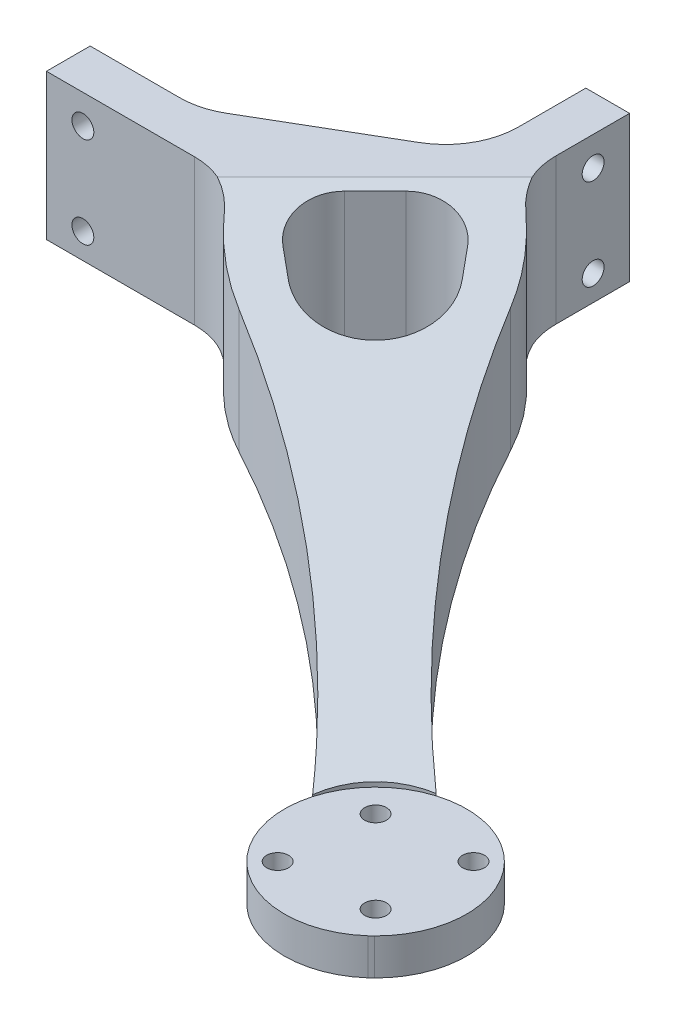
from build123d import *

# Parameters (mm, degrees)
BOSS_EXTRUDE3_DEPTH     = 25
FILLET2_R               = 30
CUT_EXTRUDE4_DEPTH      = 25
FILLET3_R               = 6
BOSS_EXTRUDE4_DEPTH     = 25
CUT_EXTRUDE6_DEPTH      = 100
CUT_EXTRUDE6_DEPTH_BACK = 100
SKETCH10_W              = 160.183879056
SKETCH10_H              = 83.114276869
SKETCH11_R              = 12.5
BOSS_EXTRUDE5_DEPTH     = 5
CUT_EXTRUDE7_START      = 100
SKETCH12_R              = 12.5
CUT_EXTRUDE7_DEPTH      = 100
SKETCH14_R              = 1.5
CUT_EXTRUDE8_DEPTH      = 10
SKETCH15_R              = 1.5
CUT_EXTRUDE9_DEPTH      = 10
FILLET6_R               = 10
SKETCH16_R              = 1.5
CUT_EXTRUDE10_DEPTH     = 10
BOSS_EXTRUDE7_DEPTH     = 7
SKETCH19_R              = 1.5
CUT_EXTRUDE12_DEPTH     = 7
FILLET7_R               = 3.5
BOSS_EXTRUDE8_START     = 1
SKETCH20_W              = 15
SKETCH20_H              = 20
SKETCH20_R              = 1.5
BOSS_EXTRUDE8_DEPTH     = 1
BOSS_EXTRUDE9_START     = 1
SKETCH21_W              = 15
SKETCH21_H              = 20
SKETCH21_R              = 1.5
BOSS_EXTRUDE9_DEPTH     = 1
BOSS_EXTRUDE10_DEPTH    = 20
FILLET8_R               = 10


# Some blends are built 0.0001 mm under size
with BuildPart() as part:
    # Sketch1 → Boss-Extrude3 (new body)
    with BuildSketch(Plane(origin=(0, 0, 0), x_dir=(1, 0, 0), z_dir=(0, 1, 0))):
        with BuildLine():
            Line((-32.833333333, 3.166666667), (-17.833333333, 3.166666667))
            Line((-17.833333333, 3.166666667), (7.166666667, 18.166666667))
            Line((7.166666667, 18.166666667), (7.166666667, 33.166666667))
            Line((7.166666667, 33.166666667), (12.166666667, 33.166666667))
            Line((12.166666667, 33.166666667), (12.166666667, 18.166666667))
            Line((12.166666667, 18.166666667), (17.527177031, 18.166666667))
            ThreePointArc((17.527177031, 18.166666667), (37.442198793, -17.327342211), (66.165661867, -46.161270611))
            ThreePointArc((66.165661867, -46.161270611), (72.395526252, -62.062192918), (56.494603945, -55.832328533))
            ThreePointArc((56.494603945, -55.832328533), (27.660675544, -27.10886546), (-7.833333333, -7.193843698))
            Line((-7.833333333, -7.193843698), (-7.833333333, -1.833333333))
            Line((-7.833333333, -1.833333333), (-32.833333333, -1.833333333))
            Line((-32.833333333, -1.833333333), (-32.833333333, 3.166666667))
        make_face()
    extrude(amount=BOSS_EXTRUDE3_DEPTH)

    # Chamfer2
    # the kernel refuses this chamfer: 6, 5.627229018 mm, written as the material it takes off along each edge
    with BuildSketch(Plane(origin=(17.527177031, -14.820831596, -18.166666667), x_dir=(-0.9997164223008481, 0, -0.023813336221376217), z_dir=(0, 1, 0))) as chamfer2_piece_1_section:
        with BuildLine():
            Line((5.702702936, 0), (-2.525905891, 5.363294445))
            Line((-2.525905891, 5.363294445), (-2.634618021, 5.31248428))
            ThreePointArc((-2.634618021, 5.31248428), (-1.288030314, 2.670484416), (-0.110572005, -0.046624369))
            Line((-0.110572005, -0.046624369), (0.0028576, -0.119965971))
            ThreePointArc((0.0028576, -0.119965971), (2.852592138, -0.052085034), (5.705560536, -0.119965971))
            Line((5.705560536, -0.119965971), (5.702702936, 0))
        make_face()
    chamfer2_piece_1 = extrude(amount=54.641663192, mode=Mode.PRIVATE)
    chamfer2_piece_1 = split(chamfer2_piece_1, bisect_by=Plane(origin=(12.166666667, 12.5, -16.425975933), z_dir=(1, 0, 0)), keep=Keep.TOP, mode=Mode.PRIVATE)
    add(chamfer2_piece_1, mode=Mode.SUBTRACT)
    with BuildSketch(Plane(origin=(-7.833333333, -15.240510768, 7.193843698), x_dir=(-0.020819858729133396, 0, -0.999783243249505), z_dir=(0, 1, 0))) as chamfer2_piece_2_section:
        with BuildLine():
            Line((6.096204307, 0), (-2.361428154, -5.028621182))
            Line((-2.361428154, -5.028621182), (-2.470415157, -4.978403325))
            ThreePointArc((-2.470415157, -4.978403325), (-1.204815622, -2.503704319), (-0.110711113, 0.046293083))
            Line((-0.110711113, 0.046293083), (0.002498383, 0.119973989))
            ThreePointArc((0.002498383, 0.119973989), (3.049279286, 0.056526689), (6.09870269, 0.119973989))
            Line((6.09870269, 0.119973989), (6.096204307, 0))
        make_face()
    chamfer2_piece_2 = extrude(amount=55.481021536, mode=Mode.PRIVATE)
    chamfer2_piece_2 = split(chamfer2_piece_2, bisect_by=Plane(origin=(-6.193350631, 12.5, 1.833333333), z_dir=(0, 0, 1)), keep=Keep.TOP, mode=Mode.PRIVATE)
    add(chamfer2_piece_2, mode=Mode.SUBTRACT)

    # Fillet2
    # the kernel refuses this fillet: 30 mm, written as the material it takes off along each edge
    with BuildSketch(Plane(origin=(19.726764246, 45.355475944, -12.880543269), x_dir=(0.42429011681478046, 0, 0.9055263092662189), z_dir=(0, -1, 0))) as fillet2_piece_1:
        with BuildLine():
            CenterArc((8.176045785, 29.990790911), FILLET2_R, 239.5660286, 29.014271836)
            Line((-7.020306331, 4.124386399), (0, 0))
            ThreePointArc((0, 0), (3.716384448, 0.046045445), (7.432768895, 0))
        make_face()
    extrude(amount=65.710951888, mode=Mode.SUBTRACT)
    with BuildSketch(Plane(origin=(-2.883559651, 47.152983024, 9.246371963), x_dir=(0.9056360428972143, 0, 0.4240558427913414), z_dir=(0, -1, 0))) as fillet2_piece_2_section:
        with BuildLine():
            CenterArc((8.898038247, -29.989092358), FILLET2_R, 91.545096469, 31.436731661)
            Line((-7.433152225, -4.823794471), (0, 0))
            ThreePointArc((0, 0), (4.044562839, -0.05453821), (8.089125679, 0))
        make_face()
    fillet2_piece_2 = extrude(amount=69.305966049, mode=Mode.PRIVATE)
    fillet2_piece_2 = split(fillet2_piece_2, bisect_by=Plane(origin=(-2.472074329, 12.5, 1.833333333), z_dir=(0, 0, 1)), keep=Keep.TOP, mode=Mode.PRIVATE)
    add(fillet2_piece_2, mode=Mode.SUBTRACT)

    # Sketch4 → Cut-Extrude4 (cut)
    with BuildSketch(Plane(origin=(0, 25, 0), x_dir=(1, 0, 0), z_dir=(0, 1, 0))):
        with BuildLine():
            Line((17.165160832, 5.209143376), (10.448403781, 13.869842848))
            Line((10.448403781, 13.869842848), (-3.421439067, 0))
            Line((-3.421439067, 0), (5.239260404, -6.716757051))
            ThreePointArc((5.239260404, -6.716757051), (16.458811421, -6.01040764), (17.165160832, 5.209143376))
        make_face()
    extrude(amount=-CUT_EXTRUDE4_DEPTH, mode=Mode.SUBTRACT)

    # Fillet3
    fillet3_edges = [part.edges().sort_by_distance(p)[0] for p in [
        (-3.421439067, 12.5, 0),
        (10.448403781, 12.5, -13.869842848),
    ]]
    fillet(fillet3_edges, radius=FILLET3_R)

    # Sketch7 → Boss-Extrude4 (add)
    with BuildSketch(Plane(origin=(0, 25, 0), x_dir=(1, 0, 0), z_dir=(0, 1, 0))):
        Polygon((8.953526914, 27.464178608), (42.758807377, -6.341101855), (46.775588972, -2.324320261), (12.970308509, 31.480960203), align=None)
    extrude(amount=BOSS_EXTRUDE4_DEPTH)

    # Sketch10 → Cut-Extrude6 (cut, two sides: drawn at the far end of the back side and taken through both)
    with BuildSketch(Plane(origin=(22.225634356, 0, -22.225634356), x_dir=(-0.7071067811865475, 0, -0.7071067811865477), z_dir=(0.7071067811865477, 0, -0.7071067811865475)).offset(-CUT_EXTRUDE6_DEPTH_BACK)):
        with Locations((-36.711585848, 10.87638512)):
            Rectangle(SKETCH10_W, SKETCH10_H)
        Polygon((-95.075965008, 0), (-95.075965008, 5), (-72.575965008, 5), (4.173398499, 25), (18.384776311, 25), (25.455844123, 25), (25.455844123, 5), (18.384776311, 5), (4.173398499, 5), (-65.075965008, 0), align=None, mode=Mode.SUBTRACT)
    extrude(amount=CUT_EXTRUDE6_DEPTH + CUT_EXTRUDE6_DEPTH_BACK, mode=Mode.SUBTRACT)

    # Sketch11 → Boss-Extrude5 (add)
    with BuildSketch(Plane(origin=(0, 5, 0), x_dir=(1, 0, 0), z_dir=(0, 1, 0))):
        with Locations((63.634495769, -53.146232797)):
            Circle(SKETCH11_R)
    extrude(amount=-BOSS_EXTRUDE5_DEPTH)

    # Sketch12 → Cut-Extrude7 (cut)
    with BuildSketch(Plane(origin=(0, 5, 0), x_dir=(1, 0, 0), z_dir=(0, 1, 0)).offset(CUT_EXTRUDE7_START)):
        with Locations((63.634495769, -53.146232797)):
            Circle(SKETCH12_R)
    extrude(amount=-CUT_EXTRUDE7_DEPTH, mode=Mode.SUBTRACT)

    # Sketch14 → Cut-Extrude8 (cut)
    with BuildSketch(Plane.ZY.offset(-7.166666667)):
        with Locations((-28.166666667, 21)):
            Circle(SKETCH14_R)
        with Locations((-28.166666667, 8.5)):
            Circle(SKETCH14_R)
    extrude(amount=-CUT_EXTRUDE8_DEPTH, mode=Mode.SUBTRACT)

    # Sketch15 → Cut-Extrude9 (cut)
    with BuildSketch(Plane(origin=(0, 0, -3.166666667), x_dir=(-1, 0, 0), z_dir=(0, 0, -1))):
        with Locations((27.833333333, 21)):
            Circle(SKETCH15_R)
        with Locations((27.833333333, 8.5)):
            Circle(SKETCH15_R)
    extrude(amount=-CUT_EXTRUDE9_DEPTH, mode=Mode.SUBTRACT)

    # Fillet6
    # the kernel refuses this fillet: 10 mm, written as the material it adds along each edge
    with BuildSketch(Plane(origin=(-7.502347281, -7.577664342, 1.833333333), x_dir=(0.5924373658705074, 0, 0.8056165139322894), z_dir=(0, 1, 0))) as fillet6_piece_1_section:
        with BuildLine():
            CenterArc((5.078393583, -9.973648871), FILLET6_R, 94.160376696, 49.509460781)
            Line((-2.977771557, -4.049275213), (0, 0))
            ThreePointArc((0, 0), (2.176454393, -0.079053386), (4.352908785, 0))
        make_face()
    fillet6_piece_1 = extrude(amount=45.100484579, mode=Mode.PRIVATE)
    fillet6_piece_1 = split(fillet6_piece_1, bisect_by=Plane(origin=(-10.464404815, 5.138408988, 1.851355811), z_dir=(-0.05092254709852862, -0.9974035233515051, -0.05092254709852862)), keep=Keep.TOP, mode=Mode.PRIVATE)
    fillet6_piece_1 = split(fillet6_piece_1, bisect_by=Plane(origin=(-10.467928872, 5, 1.847831753), z_dir=(0, 1, 0)), keep=Keep.TOP, mode=Mode.PRIVATE)
    add(fillet6_piece_1)
    with BuildSketch(Plane(origin=(-7.502347281, -7.577664342, 1.833333333), x_dir=(0.5924373658705074, 0, 0.8056165139322894), z_dir=(0, 1, 0))) as fillet6_piece_2_section:
        with BuildLine():
            CenterArc((5.078393583, -9.973648871), FILLET6_R, 94.160376696, 49.509460781)
            Line((-2.977771557, -4.049275213), (0, 0))
            ThreePointArc((0, 0), (2.176454393, -0.079053386), (4.352908785, 0))
        make_face()
    fillet6_piece_2 = extrude(amount=45.100484579, mode=Mode.PRIVATE)
    fillet6_piece_2 = split(fillet6_piece_2, bisect_by=Plane(origin=(-6.303814001, 4.830696636, 3.717827688), z_dir=(0.05092254709852862, 0.9974035233515051, 0.05092254709852862)), keep=Keep.TOP, mode=Mode.PRIVATE)
    fillet6_piece_2 = split(fillet6_piece_2, bisect_by=Plane(origin=(-6.299503336, 5, 3.722138352), z_dir=(0, -1, 0)), keep=Keep.TOP, mode=Mode.PRIVATE)
    add(fillet6_piece_2)
    with BuildSketch(Plane(origin=(-7.502347281, -7.577664342, 1.833333333), x_dir=(0.5924373658705074, 0, 0.8056165139322894), z_dir=(0, 1, 0))) as fillet6_piece_3_section:
        with BuildLine():
            CenterArc((5.078393583, -9.973648871), FILLET6_R, 94.160376696, 49.509460781)
            Line((-2.977771557, -4.049275213), (0, 0))
            ThreePointArc((0, 0), (2.176454393, -0.079053386), (4.352908785, 0))
        make_face()
    fillet6_piece_3 = extrude(amount=45.100484579, mode=Mode.PRIVATE)
    fillet6_piece_3 = split(fillet6_piece_3, bisect_by=Plane(origin=(-8.64759618, 5.034829767, 2.063320006), z_dir=(0.05092254709852862, 0.9974035233515051, 0.05092254709852862)), keep=Keep.TOP, mode=Mode.PRIVATE)
    fillet6_piece_3 = split(fillet6_piece_3, bisect_by=Plane(origin=(-6.413698514, 24.302451402, 4.297217673), z_dir=(-0.17830914996233782, -0.9676836745958967, -0.17830914996233793)), keep=Keep.TOP, mode=Mode.PRIVATE)
    fillet6_piece_3 = split(fillet6_piece_3, bisect_by=Plane(origin=(-8.143046579, 5, 2.567869607), z_dir=(0, 1, 0)), keep=Keep.TOP, mode=Mode.PRIVATE)
    fillet6_piece_3 = split(fillet6_piece_3, bisect_by=Plane(origin=(-8.143046579, 25, 2.567869607), z_dir=(0, -1, 0)), keep=Keep.TOP, mode=Mode.PRIVATE)
    add(fillet6_piece_3)
    with BuildSketch(Plane(origin=(12.166666667, 25, -18.068743425), x_dir=(0.7999623849439977, 0, 0.6000501501330627), z_dir=(0, -1, 0))) as fillet6_piece_4_section:
        with BuildLine():
            CenterArc((5.017071581, -9.976718531), FILLET6_R, 93.910453362, 49.216057169)
            Line((-2.982552268, -3.97621703), (-3.782514653, -3.37616688))
            Line((-3.782514653, -3.37616688), (-0.799962385, 0.60005015))
            Line((-0.799962385, 0.60005015), (0.042105821, 0.999113157))
            ThreePointArc((0.042105821, 0.999113157), (1.068110264, 0.955874051), (4.266901142, 0.997671853))
            Line((4.266901142, 0.997671853), (4.335098455, 0))
        make_face()
    fillet6_piece_4 = extrude(amount=20, mode=Mode.PRIVATE)
    fillet6_piece_4 = split(fillet6_piece_4, bisect_by=Plane(origin=(12.113566037, 5.056431477, -19.120947952), z_dir=(0.05092254709852862, 0.9974035233515051, 0.05092254709852862)), keep=Keep.TOP, mode=Mode.PRIVATE)
    fillet6_piece_4 = split(fillet6_piece_4, bisect_by=Plane(origin=(14.359334309, 24.376039861, -16.875179681), z_dir=(-0.17830914996233782, -0.9676836745958967, -0.17830914996233793)), keep=Keep.TOP, mode=Mode.PRIVATE)
    add(fillet6_piece_4)
    with BuildSketch(Plane(origin=(12.166666667, 25, -18.068743425), x_dir=(0.7999623849439977, 0, 0.6000501501330627), z_dir=(0, -1, 0))) as fillet6_piece_5_section:
        with BuildLine():
            CenterArc((5.017071581, -9.976718531), FILLET6_R, 93.910453362, 49.216057169)
            Line((-2.982552268, -3.97621703), (-3.782514653, -3.37616688))
            Line((-3.782514653, -3.37616688), (-0.799962385, 0.60005015))
            Line((-0.799962385, 0.60005015), (0.042105821, 0.999113157))
            ThreePointArc((0.042105821, 0.999113157), (1.068110264, 0.955874051), (4.266901142, 0.997671853))
            Line((4.266901142, 0.997671853), (4.335098455, 0))
        make_face()
    fillet6_piece_5 = extrude(amount=20, mode=Mode.PRIVATE)
    fillet6_piece_5 = split(fillet6_piece_5, bisect_by=Plane(origin=(11.727300312, 5.177477113, -21.105564102), z_dir=(-0.05092254709852862, -0.9974035233515051, -0.05092254709852862)), keep=Keep.TOP, mode=Mode.PRIVATE)
    add(fillet6_piece_5)
    with BuildSketch(Plane(origin=(12.166666667, 25, -18.068743425), x_dir=(0.7999623849439977, 0, 0.6000501501330627), z_dir=(0, -1, 0))) as fillet6_piece_6_section:
        with BuildLine():
            CenterArc((5.017071581, -9.976718531), FILLET6_R, 93.910453362, 49.216057169)
            Line((-2.982552268, -3.97621703), (-3.782514653, -3.37616688))
            Line((-3.782514653, -3.37616688), (-0.799962385, 0.60005015))
            Line((-0.799962385, 0.60005015), (0.042105821, 0.999113157))
            ThreePointArc((0.042105821, 0.999113157), (1.068110264, 0.955874051), (4.266901142, 0.997671853))
            Line((4.266901142, 0.997671853), (4.335098455, 0))
        make_face()
    fillet6_piece_6 = extrude(amount=32.426262487, mode=Mode.PRIVATE)
    fillet6_piece_6 = split(fillet6_piece_6, bisect_by=Plane(origin=(14.095782292, 4.806456237, -16.206979714), z_dir=(0.05092254709852862, 0.9974035233515051, 0.05092254709852862)), keep=Keep.TOP, mode=Mode.PRIVATE)
    fillet6_piece_6 = split(fillet6_piece_6, bisect_by=Plane(origin=(14.100710146, 5, -16.20205186), z_dir=(0, -1, 0)), keep=Keep.TOP, mode=Mode.PRIVATE)
    add(fillet6_piece_6)

    # Sketch16 → Cut-Extrude10 (cut)
    with BuildSketch(Plane(origin=(0, 5, 0), x_dir=(1, 0, 0), z_dir=(0, 1, 0))):
        with Locations(Location((70.35201019, -46.428718376, 0), (0, 0, 270))):
            Circle(SKETCH16_R)
        with Locations(Location((57.97764152, -47.489378547, 0), (0, 0, 270))):
            Circle(SKETCH16_R)
        with Locations(Location((56.916981348, -59.863747218, 0), (0, 0, 270))):
            Circle(SKETCH16_R)
        with Locations(Location((69.291350019, -58.803087046, 0), (0, 0, 270))):
            Circle(SKETCH16_R)
    extrude(amount=-CUT_EXTRUDE10_DEPTH, mode=Mode.SUBTRACT)

    # Sketch17 → Boss-Extrude7 (add)
    with BuildSketch(Plane.XZ):
        Polygon((65.048708428, 56.68176851), (67.170027868, 54.560447263), (62.220278291, 49.610701903), (60.098958851, 51.73202315), align=None)
    extrude(amount=BOSS_EXTRUDE7_DEPTH)

    # Sketch19 → Cut-Extrude12 (cut)
    with BuildSketch(Plane(origin=(6.304761689, 0, -6.304767061), x_dir=(-0.7071070824005901, 0, -0.7071064799723766), z_dir=(0.7071064799723766, 0, -0.7071070824005901))):
        with Locations((-82.57644824, -3.5)):
            Circle(SKETCH19_R)
    extrude(amount=-CUT_EXTRUDE12_DEPTH, mode=Mode.SUBTRACT)

    # Fillet7
    fillet7_edges = [part.edges().sort_by_distance(p)[0] for p in [
        (61.159618571, -7, 50.671362527),
        (66.109368148, -7, 55.621107886),
    ]]
    fillet(fillet7_edges, radius=FILLET7_R - 0.0001)  # a hair under: the kernel refuses the full size

    # Sketch20 → Boss-Extrude8 (add)
    with BuildSketch(Plane.ZY.offset(-7.166666667).offset(BOSS_EXTRUDE8_START)):
        with Locations((-25.666666667, 15)):
            Rectangle(SKETCH20_W, SKETCH20_H)
        with Locations((-28.166666667, 21)):
            Circle(SKETCH20_R, mode=Mode.SUBTRACT)
        with Locations((-28.166666667, 8.5)):
            Circle(SKETCH20_R, mode=Mode.SUBTRACT)
    extrude(amount=-BOSS_EXTRUDE8_DEPTH)

    # Sketch21 → Boss-Extrude9 (add)
    with BuildSketch(Plane(origin=(0, 0, -3.166666667), x_dir=(-1, 0, 0), z_dir=(0, 0, -1)).offset(BOSS_EXTRUDE9_START)):
        with Locations((25.333333333, 15)):
            Rectangle(SKETCH21_W, SKETCH21_H)
        with Locations((27.833333333, 21)):
            Circle(SKETCH21_R, mode=Mode.SUBTRACT)
        with Locations((27.833333333, 8.5)):
            Circle(SKETCH21_R, mode=Mode.SUBTRACT)
    extrude(amount=-BOSS_EXTRUDE9_DEPTH)

    # Sketch22 → Boss-Extrude10 (add)
    with BuildSketch(Plane(origin=(0, 25, 0), x_dir=(1, 0, 0), z_dir=(0, 1, 0))):
        Polygon((-17.833333333, 4.166666667), (6.166666667, 18.166666667), (7.166666667, 18.166666667), (-16.710835108, 1.271788267), (-20.312073149, 2.433477958), align=None)
    extrude(amount=-BOSS_EXTRUDE10_DEPTH)

    # Fillet8
    fillet8_edges = [part.edges().sort_by_distance(p)[0] for p in [
        (6.166666667, 15, -18.166666667),
        (-17.833333333, 15, -4.166666667),
    ]]
    fillet(fillet8_edges, radius=FILLET8_R)


solid = part.part
